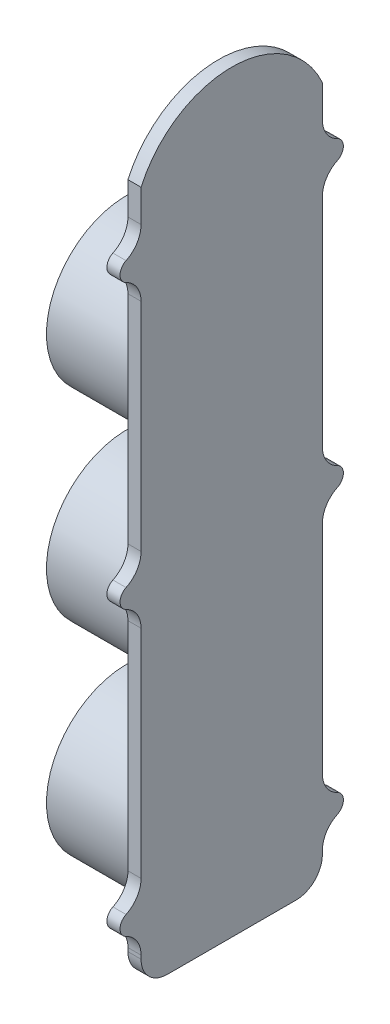
from build123d import *

# Parameters (mm, degrees)
BOSS_EXTRUDE2_START = 50
BOSS_EXTRUDE2_DEPTH = 5
BOSS_EXTRUDE3_START = 55
SKETCH3_R           = 30.5
SKETCH3_R_2         = 25.5
BOSS_EXTRUDE3_DEPTH = 35


# Read off the part's stored shape, not the designer's step: Intersect2
with BuildPart() as part:
    # Sketch2<8> → Boss-Extrude2 (new body)
    with BuildSketch(Plane(origin=(0, 0, 0), x_dir=(0, 0, -1), z_dir=(1, 0, 0)).offset(BOSS_EXTRUDE2_START)):
        with BuildLine():
            Line((-34.5, 78.446358794), (-34.5, 66.149110641))
            ThreePointArc((-34.5, 66.149110641), (-36.048457453, 60.803885802), (-40.214285714, 57.114031612))
            ThreePointArc((-40.214285714, 57.114031612), (-42.5, 53.5), (-40.214285714, 49.885968388))
            ThreePointArc((-40.214285714, 49.885968388), (-36.048457453, 46.196114198), (-34.5, 40.850889359))
            Line((-34.5, 40.850889359), (-34.5, -41.600889359))
            ThreePointArc((-34.5, -41.600889359), (-36.048457453, -46.946114198), (-40.214285714, -50.635968388))
            ThreePointArc((-40.214285714, -50.635968388), (-42.5, -54.25), (-40.214285714, -57.864031612))
            ThreePointArc((-40.214285714, -57.864031612), (-36.048457453, -61.553885802), (-34.5, -66.899110641))
            Line((-34.5, -66.899110641), (-34.5, -149.350889359))
            ThreePointArc((-34.5, -149.350889359), (-36.048457453, -154.696114198), (-40.214285714, -158.385968388))
            ThreePointArc((-40.214285714, -158.385968388), (-42.5, -162), (-40.214285714, -165.614031612))
            ThreePointArc((-40.214285714, -165.614031612), (-36.048457453, -169.303885802), (-34.5, -174.649110641))
            Line((-34.5, -174.649110641), (-34.5, -176))
            ThreePointArc((-34.5, -176), (-31.571067812, -183.071067812), (-24.5, -186))
            Line((-24.5, -186), (24.5, -186))
            ThreePointArc((24.5, -186), (31.571067812, -183.071067812), (34.5, -176))
            Line((34.5, -176), (34.5, -174.649110641))
            ThreePointArc((34.5, -174.649110641), (36.048457453, -169.303885802), (40.214285714, -165.614031612))
            ThreePointArc((40.214285714, -165.614031612), (42.5, -162), (40.214285714, -158.385968388))
            ThreePointArc((40.214285714, -158.385968388), (36.048457453, -154.696114198), (34.5, -149.350889359))
            Line((34.5, -149.350889359), (34.5, -66.899110641))
            ThreePointArc((34.5, -66.899110641), (36.048457453, -61.553885802), (40.214285714, -57.864031612))
            ThreePointArc((40.214285714, -57.864031612), (42.5, -54.25), (40.214285714, -50.635968388))
            ThreePointArc((40.214285714, -50.635968388), (36.048457453, -46.946114198), (34.5, -41.600889359))
            Line((34.5, -41.600889359), (34.5, 40.850889359))
            ThreePointArc((34.5, 40.850889359), (36.048457453, 46.196114198), (40.214285714, 49.885968388))
            ThreePointArc((40.214285714, 49.885968388), (42.5, 53.5), (40.214285714, 57.114031612))
            ThreePointArc((40.214285714, 57.114031612), (36.048457453, 60.803885802), (34.5, 66.149110641))
            Line((34.5, 66.149110641), (34.5, 78.446358794))
            ThreePointArc((34.5, 78.446358794), (0, 100.8), (-34.5, 78.446358794))
        make_face()
    boss_extrude2 = extrude(amount=BOSS_EXTRUDE2_DEPTH)

    # Sketch3 → Boss-Extrude3 (add)
    # profile 1 of 3: a face of its own
    with BuildSketch(Plane(origin=(0, 0, 0), x_dir=(0, 0, -1), z_dir=(1, 0, 0)).offset(BOSS_EXTRUDE3_START)):
        with Locations((0, -146.5)):
            Circle(SKETCH3_R)
        with Locations((0, -146.5)):
            Circle(SKETCH3_R_2, mode=Mode.SUBTRACT)
    # profile 2 of 3: a face of its own
    with BuildSketch(Plane(origin=(0, 0, 0), x_dir=(0, 0, -1), z_dir=(1, 0, 0)).offset(BOSS_EXTRUDE3_START)):
        with Locations((0, -69.25)):
            Circle(SKETCH3_R)
        with Locations((0, -69.25)):
            Circle(SKETCH3_R_2, mode=Mode.SUBTRACT)
    # profile 3 of 3: a face of its own
    with BuildSketch(Plane(origin=(0, 0, 0), x_dir=(0, 0, -1), z_dir=(1, 0, 0)).offset(BOSS_EXTRUDE3_START)):
        with Locations((0, 8)):
            Circle(SKETCH3_R)
        with Locations((0, 8)):
            Circle(SKETCH3_R_2, mode=Mode.SUBTRACT)
    boss_extrude3 = extrude(amount=BOSS_EXTRUDE3_DEPTH)

    # Mirror3: Boss-Extrude2, Boss-Extrude3 across plane
    add(boss_extrude2.mirror(Plane.ZY.offset(-50)))
    add(boss_extrude3.mirror(Plane.ZY.offset(-50)))


with BuildPart() as body_2:
    # Intersect2: the piece on the far side of the plane
    add(part.part)
    split(bisect_by=Plane.YZ.offset(50), keep=Keep.BOTTOM)


with BuildPart() as part_1:
    add(part.part)

    # Intersect2
    split(bisect_by=Plane.YZ.offset(50), keep=Keep.TOP)


solid = body_2.part
